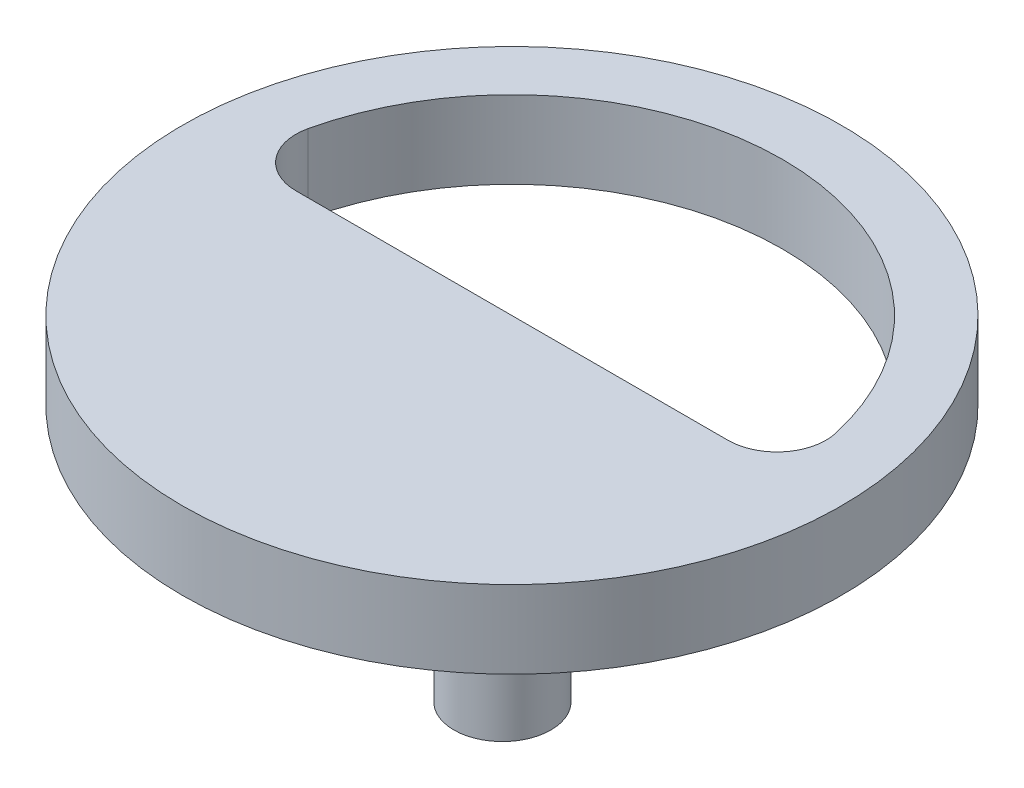
from build123d import *

# Parameters (mm, degrees)
SKETCH_1_R      = 8.490267481
EXTRUDE_1_DEPTH = 2
SKETCH_2_R      = 1.25
EXTRUDE_2_DEPTH = 2.5


with BuildPart() as part:
    # Эскиз1 → Бобышка-Вытянуть1 (new body)
    with BuildSketch(Plane(origin=(0, 0, 0), x_dir=(1, 0, 0), z_dir=(0, 1, 0))):
        Circle(SKETCH_1_R)
        with BuildLine():
            Line((5.565646409, 0), (-5.565646409, 0))
            ThreePointArc((-5.565646409, 0), (-6.552289655, 0.474742908), (-6.796984316, 1.5419684))
            ThreePointArc((-6.796984316, 1.5419684), (0, 6.969696), (6.796984316, 1.5419684))
            ThreePointArc((6.796984316, 1.5419684), (6.552289655, 0.474742908), (5.565646409, 0))
        make_face(mode=Mode.SUBTRACT)
    extrude(amount=EXTRUDE_1_DEPTH)

    # Эскиз2 → Бобышка-Вытянуть2 (add)
    with BuildSketch(Plane.XZ):
        with Locations((-4, 4.24513374)):
            Circle(SKETCH_2_R)
        with Locations((4, 4.24513374)):
            Circle(SKETCH_2_R)
    extrude(amount=EXTRUDE_2_DEPTH)


solid = part.part
